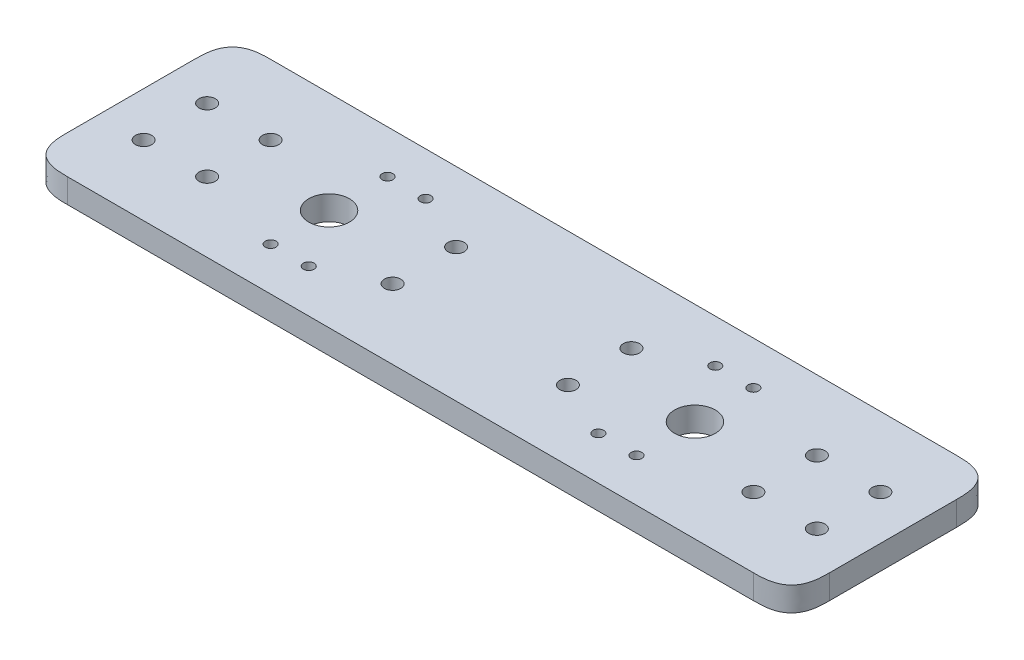
from build123d import *

# Parameters (mm, degrees)
SKETCH1_W                     = 300
SKETCH1_H                     = 80
BOSS_EXTRUDE1_DEPTH           = 9.525
SKETCH5_R                     = 8
CUT_EXTRUDE1_DEPTH            = 156.533680034
FILLET1_SIZE                  = 15
M5X0_8_START                  = -1
M5X0_8_TAPPED_HOLE1_OUTLINE_R = 2.1
M5X0_8_TAPPED_HOLE1_DEPTH     = 12
M6_CLEARANCE_HOLE1_D          = 6.4


with BuildPart() as part:
    # Sketch1 → Boss-Extrude1 (new body)
    with BuildSketch(Plane(origin=(0, 0, 0), x_dir=(1, 0, 0), z_dir=(0, 1, 0))):
        Rectangle(SKETCH1_W, SKETCH1_H)
    extrude(amount=BOSS_EXTRUDE1_DEPTH)

    # Sketch5 → Cut-Extrude1 (cut, through all)
    with BuildSketch(Plane(origin=(0, 9.525, 0), x_dir=(1, 0, 0), z_dir=(0, 1, 0))):
        with Locations(Location((-72, 0, 0), (0, 0, 270))):
            Circle(SKETCH5_R)
        with Locations(Location((72, 0, 0), (0, 0, 270))):
            Circle(SKETCH5_R)
    extrude(amount=-CUT_EXTRUDE1_DEPTH, mode=Mode.SUBTRACT)

    # Fillet1
    # a fillet whose section is not a circle: 15 mm, written as the material it takes off along each edge
    with BuildSketch(Plane(origin=(150, -37.5, 40), x_dir=(0, 0, -1), z_dir=(0, 1, 0)), Plane(origin=(150, -37.5, -40), x_dir=(-1, 0, 0), z_dir=(0, 1, 0))) as fillet1_piece_1:
        with BuildLine():
            add(Edge.make_bspline([(FILLET1_SIZE, 0), (FILLET1_SIZE * 0.831801948466, 0), (FILLET1_SIZE * 0.663603896932, 0), (FILLET1_SIZE * 0.292893218813, FILLET1_SIZE * 0.0716919198361), (FILLET1_SIZE * 0.0716919198361, FILLET1_SIZE * 0.292893218813), (0, FILLET1_SIZE * 0.663603896932), (0, FILLET1_SIZE * 0.831801948466), (0, FILLET1_SIZE)], knots=[0, 0, 0, 0, 0, 0, 0.5, 0.5, 1, 1, 1, 1, 1, 1], degree=5))
            Line((0, FILLET1_SIZE), (0, 0))
            Line((0, 0), (FILLET1_SIZE, 0))
        make_face()
    extrude(amount=84.525, mode=Mode.SUBTRACT)
    with BuildSketch(Plane(origin=(-150, -37.5, -40), x_dir=(1, 0, 0), z_dir=(0, 1, 0)), Plane(origin=(-150, -37.5, 40), x_dir=(0, 0, -1), z_dir=(0, 1, 0))) as fillet1_piece_2:
        with BuildLine():
            add(Edge.make_bspline([(FILLET1_SIZE, 0), (FILLET1_SIZE * 0.831801948466, 0), (FILLET1_SIZE * 0.663603896932, 0), (FILLET1_SIZE * 0.292893218813, -FILLET1_SIZE * 0.0716919198361), (FILLET1_SIZE * 0.0716919198361, -FILLET1_SIZE * 0.292893218813), (0, -FILLET1_SIZE * 0.663603896932), (0, -FILLET1_SIZE * 0.831801948466), (0, -FILLET1_SIZE)], knots=[0, 0, 0, 0, 0, 0, 0.5, 0.5, 1, 1, 1, 1, 1, 1], degree=5))
            Line((0, -FILLET1_SIZE), (0, 0))
            Line((0, 0), (FILLET1_SIZE, 0))
        make_face()
    extrude(amount=84.525, mode=Mode.SUBTRACT)

    # M5x0.8 Tapped Hole1: read off the stored shape, not the designer's step
    # M5x0.8 Tapped Hole1 outline → M5x0.8 Tapped Hole1 (cut)
    with BuildSketch(Plane(origin=(0, 0, 0), x_dir=(1, 0, 0), z_dir=(0, 1, 0)).offset(M5X0_8_START)):
        with Locations((57, 23)):
            Circle(M5X0_8_TAPPED_HOLE1_OUTLINE_R)
        with Locations((72, -23)):
            Circle(M5X0_8_TAPPED_HOLE1_OUTLINE_R)
        with Locations((57, -23)):
            Circle(M5X0_8_TAPPED_HOLE1_OUTLINE_R)
        with Locations((72, 23)):
            Circle(M5X0_8_TAPPED_HOLE1_OUTLINE_R)
        with Locations((-57, -23)):
            Circle(M5X0_8_TAPPED_HOLE1_OUTLINE_R)
        with Locations((-72, 23)):
            Circle(M5X0_8_TAPPED_HOLE1_OUTLINE_R)
        with Locations((-57, 23)):
            Circle(M5X0_8_TAPPED_HOLE1_OUTLINE_R)
        with Locations((-72, -23)):
            Circle(M5X0_8_TAPPED_HOLE1_OUTLINE_R)
    extrude(amount=M5X0_8_TAPPED_HOLE1_DEPTH, mode=Mode.SUBTRACT)

    # M6 Clearance Hole1 (through all)
    with Locations(Plane(origin=(0, 0, 0), x_dir=(-1, 0, 0), z_dir=(0, -1, 0))):
        with Locations((132.5, -12.5), (107.5, -12.5), (132.5, 12.5), (107.5, 12.5), (-107.5, -12.5), (-107.5, 12.5), (-132.5, -12.5), (-132.5, 12.5), (34.5, -12.5), (34.5, 12.5), (-34.5, -12.5), (-34.5, 12.5)):
            Hole(M6_CLEARANCE_HOLE1_D / 2)


solid = part.part
